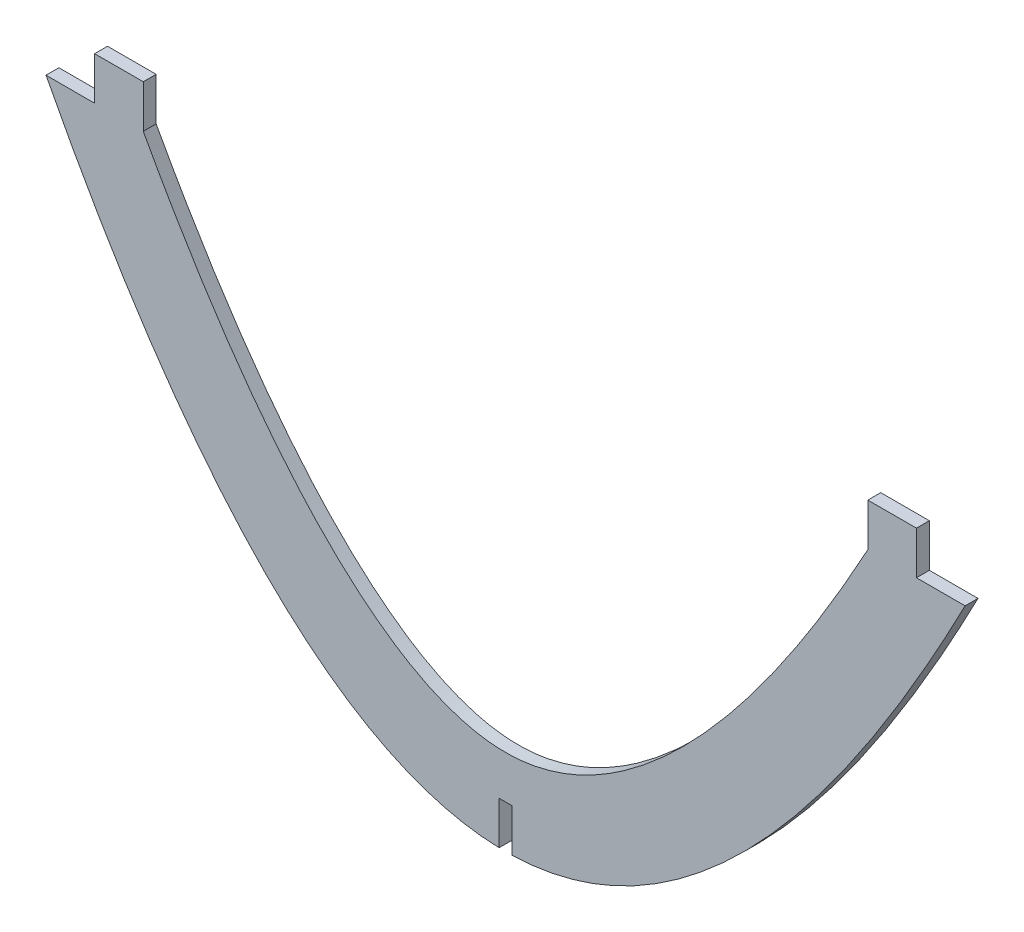
from build123d import *

# Parameters (mm, degrees)
BOSS_EXTRUDE1_DEPTH = 3
SKETCH2_W           = 3
SKETCH2_H           = 11.487699198
CUT_EXTRUDE1_DEPTH  = 16


# Read off the part's stored shape, not the designer's step: Boss-Extrude1
with BuildPart() as part:
    # Boss-Extrude1 outline → Boss-Extrude1 (new body)
    with BuildSketch(Plane.XY):
        with BuildLine():
            Line((-95.687613819, 113.066263652), (-95.687613819, 103.066263652))
            Line((-95.687613819, 103.066263652), (-107.013116357, 103.066263652))
            add(Edge.make_bspline(
                [(-107.013116357, 103.066263652), (0, -103.066263652), (107.013116357, 103.066263652)],
                knots=[0.057157488, 0.057157488, 0.057157488, 0.942842512, 0.942842512, 0.942842512], degree=2))
            Line((107.013116357, 103.066263652), (95.68761382, 103.066263652))
            Line((95.68761382, 103.066263652), (95.68761382, 113.066263652))
            Line((95.68761382, 113.066263652), (84.362111282, 113.066263652))
            Line((84.362111282, 113.066263652), (84.362111282, 103.066263652))
            add(Edge.make_bspline(
                [(84.362111282, 103.066263652), (77.169203523, 89.870321464), (60.617973136, 63.983872026), (42.369102372, 42.101536817), (28.30806557, 30.298322138), (17.949926074, 24.101443082), (8.601675425, 20.762226356), (-2.4893e-05, 19.742494759), (-8.601757959, 20.762212203), (-17.949851697, 24.101471728), (-28.308921959, 30.298047433), (-39.552364136, 39.742329541), (-51.44403726, 52.605304358), (-63.778998477, 68.925840315), (-77.169000129, 89.870127882), (-84.362111282, 103.066263652)],
                knots=[0.078216729, 0.078216729, 0.078216729, 0.140190459, 0.22322343, 0.306256401, 0.361611715, 0.416967029, 0.472322343, 0.527677657, 0.583032971, 0.638388285, 0.693743599, 0.749098913, 0.804454227, 0.859809541, 0.921783758, 0.921783758, 0.921783758], degree=2))
            Line((-84.362111282, 103.066263652), (-84.362111282, 113.066263652))
            Line((-84.362111282, 113.066263652), (-95.687613819, 113.066263652))
        make_face()
    extrude(amount=BOSS_EXTRUDE1_DEPTH)

    # Sketch2 → Cut-Extrude1 (cut)
    with BuildSketch(Plane.XY):
        with Locations((0, 4.256150401)):
            Rectangle(SKETCH2_W, SKETCH2_H)
    extrude(amount=CUT_EXTRUDE1_DEPTH, mode=Mode.SUBTRACT)


solid = part.part
